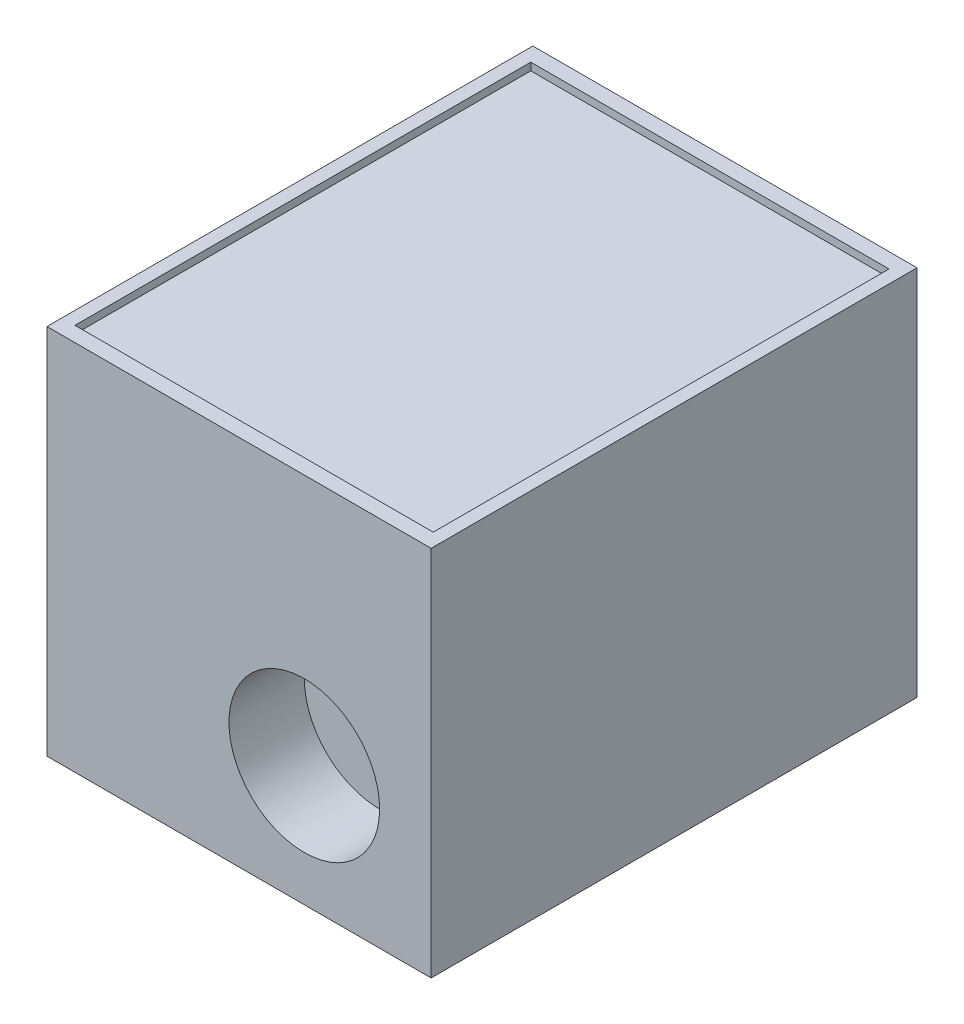
from build123d import *

# Parameters (mm, degrees)
SKETCH1_W           = 51
SKETCH1_H           = 64.5
BOSS_EXTRUDE1_DEPTH = 49.4
SKETCH2_R           = 10
CUT_EXTRUDE1_DEPTH  = 10
SKETCH3_W           = 47.55649051
SKETCH3_H           = 60.50962022
CUT_EXTRUDE2_DEPTH  = 1
SKETCH4_R           = 1.75
CUT_EXTRUDE3_DEPTH  = 5


with BuildPart() as part:
    # Sketch1 → Boss-Extrude1 (new body)
    with BuildSketch(Plane(origin=(0, 0, 0), x_dir=(1, 0, 0), z_dir=(0, 1, 0))):
        Rectangle(SKETCH1_W, SKETCH1_H)
    extrude(amount=BOSS_EXTRUDE1_DEPTH)

    # Sketch2 → Cut-Extrude1 (cut)
    with BuildSketch(Plane.XY.offset(32.25)):
        with Locations((8.66, 16)):
            Circle(SKETCH2_R)
    extrude(amount=-CUT_EXTRUDE1_DEPTH, mode=Mode.SUBTRACT)

    # Sketch3 → Cut-Extrude2 (cut)
    with BuildSketch(Plane(origin=(0, 49.4, 0), x_dir=(1, 0, 0), z_dir=(0, 1, 0))):
        Rectangle(SKETCH3_W, SKETCH3_H)
    extrude(amount=-CUT_EXTRUDE2_DEPTH, mode=Mode.SUBTRACT)

    # Sketch4 → Cut-Extrude3 (cut)
    with BuildSketch(Plane.XZ):
        with Locations((-5.5, 27.25)):
            Circle(SKETCH4_R)
        with Locations((14.5, 27.25)):
            Circle(SKETCH4_R)
        with Locations((14.5, -13.25)):
            Circle(SKETCH4_R)
        with Locations((-5.5, -13.25)):
            Circle(SKETCH4_R)
    extrude(amount=-CUT_EXTRUDE3_DEPTH, mode=Mode.SUBTRACT)


solid = part.part
